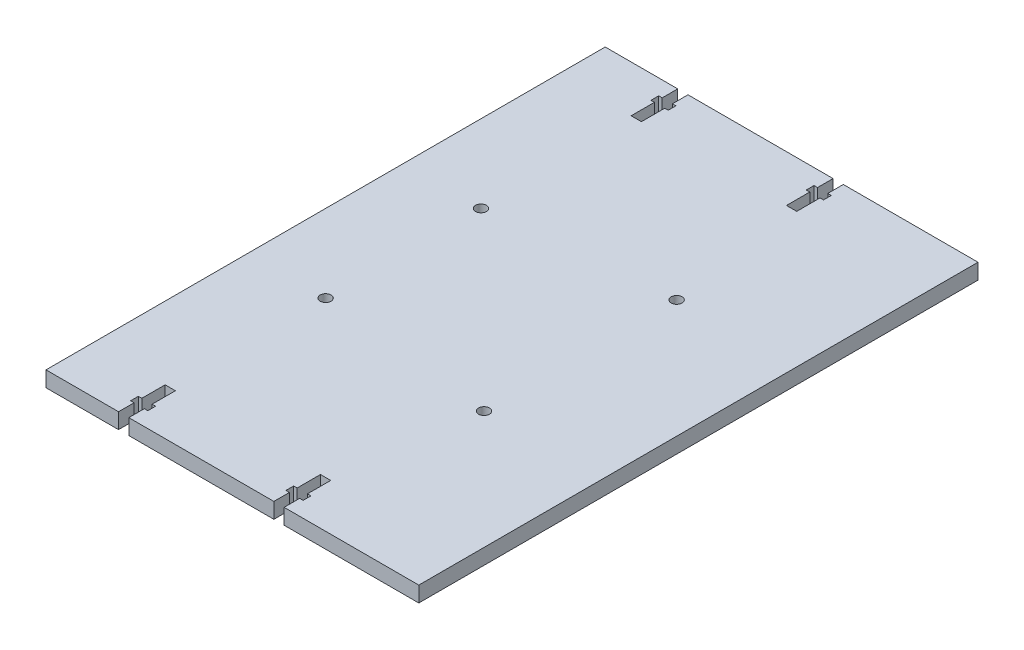
from build123d import *

# Parameters (mm, degrees)
SKETCH1_W           = 120
SKETCH1_H           = 180
BOSS_EXTRUDE1_DEPTH = 5
CUT_EXTRUDE1_DEPTH  = 5
SKETCH3_R           = 1.75
CUT_EXTRUDE2_DEPTH  = 5


with BuildPart() as part:
    # Sketch1 → Boss-Extrude1 (new body)
    with BuildSketch(Plane(origin=(0, 0, 0), x_dir=(1, 0, 0), z_dir=(0, 1, 0))):
        with Locations((60, 90)):
            Rectangle(SKETCH1_W, SKETCH1_H)
    extrude(amount=BOSS_EXTRUDE1_DEPTH)

    # Sketch2 → Cut-Extrude1 (cut)
    with BuildSketch(Plane(origin=(0, 5, 0), x_dir=(1, 0, 0), z_dir=(0, 1, 0))):
        Polygon((23.35, 15), (26.65, 15), (26.65, 7.5), (27.775, 7.5), (27.775, 5), (26.65, 5), (26.65, 0), (23.35, 0), (23.35, 5), (22.225, 5), (22.225, 7.5), (23.35, 7.5), align=None)
        Polygon((76.65, 15), (76.65, 7.5), (77.775, 7.5), (77.775, 5), (76.65, 5), (76.65, 0), (73.35, 0), (73.35, 5), (72.225, 5), (72.225, 7.5), (73.35, 7.5), (73.35, 15), align=None)
        Polygon((76.65, 165), (73.35, 165), (73.35, 172.5), (72.225, 172.5), (72.225, 175), (73.35, 175), (73.35, 180), (76.65, 180), (76.65, 175), (77.775, 175), (77.775, 172.5), (76.65, 172.5), align=None)
        Polygon((23.35, 165), (23.35, 172.5), (22.225, 172.5), (22.225, 175), (23.35, 175), (23.35, 180), (26.65, 180), (26.65, 175), (27.775, 175), (27.775, 172.5), (26.65, 172.5), (26.65, 165), align=None)
    extrude(amount=-CUT_EXTRUDE1_DEPTH, mode=Mode.SUBTRACT)

    # Sketch3 → Cut-Extrude2 (cut)
    with BuildSketch(Plane(origin=(0, 5, 0), x_dir=(1, 0, 0), z_dir=(0, 1, 0))):
        with Locations((25, 65)):
            Circle(SKETCH3_R)
        with Locations((82, 59)):
            Circle(SKETCH3_R)
        with Locations((25, 115)):
            Circle(SKETCH3_R)
        with Locations((82, 121)):
            Circle(SKETCH3_R)
    extrude(amount=-CUT_EXTRUDE2_DEPTH, mode=Mode.SUBTRACT)


solid = part.part
